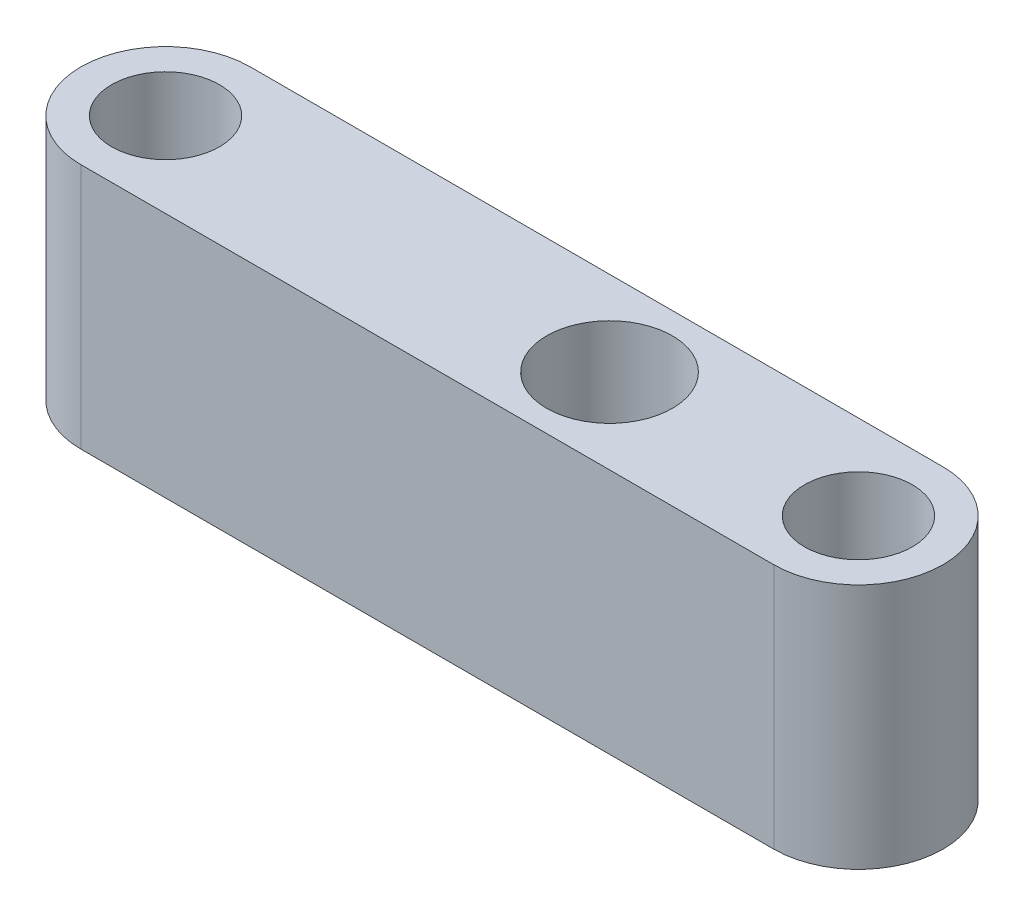
from build123d import *

# Parameters (mm, degrees)
BOSS_EXTRUDE1_DEPTH = 9.6
SKETCH2_R           = 2.1
CUT_EXTRUDE1_DEPTH  = 20.628805364
SKETCH3_R           = 2.45
CUT_EXTRUDE2_DEPTH  = 20.628805364


with BuildPart() as part:
    # Sketch1 → Boss-Extrude1 (new body)
    with BuildSketch(Plane(origin=(0, 0, 0), x_dir=(1, 0, 0), z_dir=(0, 1, 0))):
        with BuildLine():
            ThreePointArc((-13.5, 3.3), (-16.8, 0), (-13.5, -3.3))
            Line((-13.5, -3.3), (13.5, -3.3))
            ThreePointArc((13.5, -3.3), (16.8, 0), (13.5, 3.3))
            Line((13.5, 3.3), (-13.5, 3.3))
        make_face()
    extrude(amount=BOSS_EXTRUDE1_DEPTH)

    # Sketch2 → Cut-Extrude1 (cut, through all)
    with BuildSketch(Plane(origin=(0, 9.6, 0), x_dir=(1, 0, 0), z_dir=(0, 1, 0))):
        with Locations((-13.5, 0)):
            Circle(SKETCH2_R)
    cut_extrude1 = extrude(amount=-CUT_EXTRUDE1_DEPTH, mode=Mode.SUBTRACT)

    # Mirror1: Cut-Extrude1 across plane
    add(cut_extrude1.mirror(Plane(origin=(0, 0, 0), x_dir=(0, 0, 1), z_dir=(1, 0, 0))), mode=Mode.SUBTRACT)

    # Sketch3 → Cut-Extrude2 (cut, through all)
    with BuildSketch(Plane(origin=(0, 9.6, 0), x_dir=(1, 0, 0), z_dir=(0, 1, 0))):
        with Locations((3.8, 0)):
            Circle(SKETCH3_R)
    extrude(amount=-CUT_EXTRUDE2_DEPTH, mode=Mode.SUBTRACT)


solid = part.part
